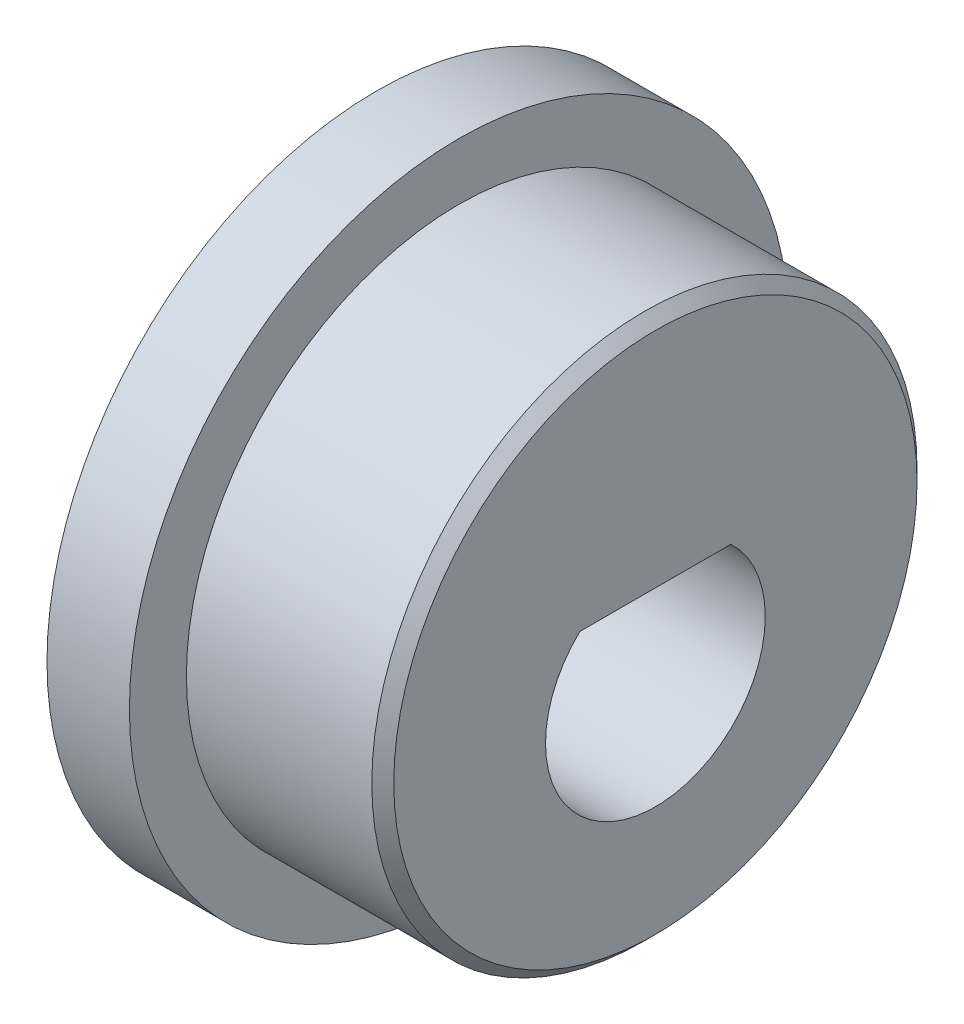
from build123d import *

# Parameters (mm, degrees)
SKIZZE1_R                            = 9.925
AUFSATZ_LINEAR_AUSTRAGEN1_DEPTH      = 7.15
SKIZZE2_R                            = 12
AUFSATZ_LINEAR_AUSTRAGEN2_DEPTH      = 3
SCHNITT_LINEAR_AUSTRAGEN2_DEPTH      = 21.718892345
SCHNITT_LINEAR_AUSTRAGEN2_DEPTH_BACK = 21.718892345
FASE1_SIZE                           = 0.4


with BuildPart() as part:
    # Skizze1 → Aufsatz-Linear austragen1 (new body)
    with BuildSketch(Plane(origin=(0, 0, 0), x_dir=(0, 0, -1), z_dir=(1, 0, 0))):
        with Locations((0, 1.5)):
            Circle(SKIZZE1_R)
    extrude(amount=AUFSATZ_LINEAR_AUSTRAGEN1_DEPTH)

    # Skizze2 → Aufsatz-Linear austragen2 (add)
    with BuildSketch(Plane.ZY):
        with Locations((0, 1.5)):
            Circle(SKIZZE2_R)
    extrude(amount=AUFSATZ_LINEAR_AUSTRAGEN2_DEPTH)

    # Skizze3 → Schnitt-Linear austragen2 (cut, two sides: drawn at the far end of the back side and taken through both)
    with BuildSketch(Plane(origin=(7.15, 0, 0), x_dir=(0, 0, -1), z_dir=(1, 0, 0)).offset(-SCHNITT_LINEAR_AUSTRAGEN2_DEPTH_BACK)):
        with BuildLine():
            Line((-2.75, 2.90473751), (2.75, 2.90473751))
            ThreePointArc((2.75, 2.90473751), (0, -4), (-2.75, 2.90473751))
        make_face()
    extrude(amount=SCHNITT_LINEAR_AUSTRAGEN2_DEPTH + SCHNITT_LINEAR_AUSTRAGEN2_DEPTH_BACK, mode=Mode.SUBTRACT)

    # Fase1
    fase1_edges = [part.edges().sort_by_distance(p)[0] for p in [
        (7.15, 1.5, 9.925),
    ]]
    chamfer(fase1_edges, length=FASE1_SIZE)


solid = part.part
